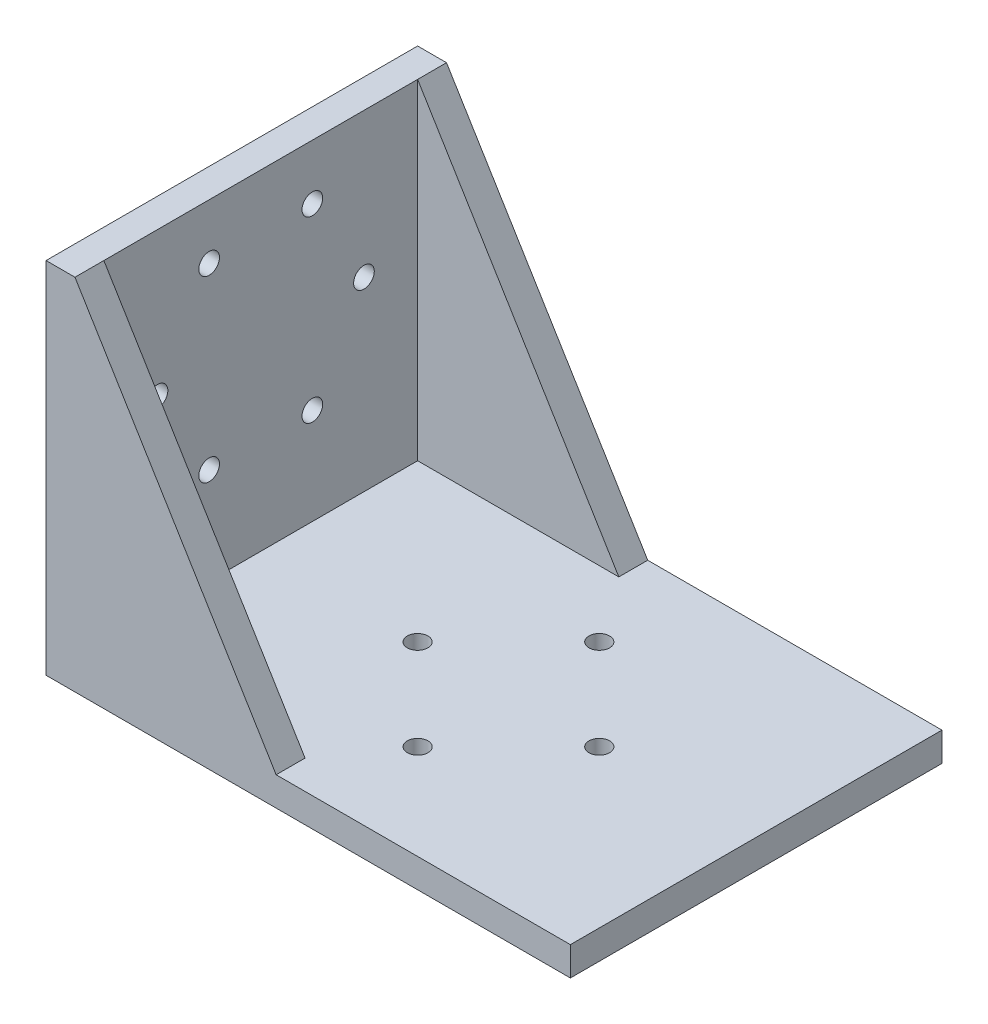
from build123d import *

# Parameters (mm, degrees)
SKETCH_1_W          = 120
SKETCH_1_H          = 70
EXTRUDE_1_DEPTH     = 7
SKETCH_2_R          = 2.5
CUT_EXTRUDE_2_DEPTH = 7
SKETCH_5_W          = 70
SKETCH_5_H          = 87
EXTRUDE_4_DEPTH     = 7
SKETCH_6_R          = 2.5
CUT_EXTRUDE_3_DEPTH = 7
EXTRUDE_5_DEPTH     = 10
EXTRUDE_6_DEPTH     = 10
EXTRUDE_7_DEPTH     = 7
EXTRUDE_8_DEPTH     = 7


with BuildPart() as part:
    # 草图1 → 凸台-拉伸1 (new body)
    with BuildSketch(Plane(origin=(0, 0, 0), x_dir=(1, 0, 0), z_dir=(0, 1, 0))):
        with Locations((60, 35)):
            Rectangle(SKETCH_1_W, SKETCH_1_H)
    extrude(amount=EXTRUDE_1_DEPTH)

    # 草图2 → 切除-拉伸2 (cut)
    with BuildSketch(Plane(origin=(0, 7, 0), x_dir=(1, 0, 0), z_dir=(0, 1, 0))):
        with Locations((82, 35)):
            Circle(SKETCH_2_R)
        with Locations((60, 13)):
            Circle(SKETCH_2_R)
        with Locations((38, 35)):
            Circle(SKETCH_2_R)
        with Locations((60, 57)):
            Circle(SKETCH_2_R)
    extrude(amount=-CUT_EXTRUDE_2_DEPTH, mode=Mode.SUBTRACT)

    # 草图5 → 凸台-拉伸4 (add)
    with BuildSketch(Plane.ZY):
        with Locations((-35, 43.5)):
            Rectangle(SKETCH_5_W, SKETCH_5_H)
    extrude(amount=EXTRUDE_4_DEPTH)

    # 草图6 → 切除-拉伸3 (cut)
    with BuildSketch(Plane.ZY.offset(7)):
        with Locations((-10, 52)):
            Circle(SKETCH_6_R)
        with Locations((-22.5, 30.349364905)):
            Circle(SKETCH_6_R)
        with Locations((-47.5, 30.349364905)):
            Circle(SKETCH_6_R)
        with Locations((-60, 52)):
            Circle(SKETCH_6_R)
        with Locations((-47.5, 73.650635095)):
            Circle(SKETCH_6_R)
        with Locations((-22.5, 73.650635095)):
            Circle(SKETCH_6_R)
    extrude(amount=-CUT_EXTRUDE_3_DEPTH, mode=Mode.SUBTRACT)

    # 草图7 → 凸台-拉伸5 (add)
    with BuildSketch(Plane.XY):
        Polygon((0, 87), (0, 7), (120, 7), (120, 0), (-7, 0), (-7, 87), align=None)
    extrude(amount=EXTRUDE_5_DEPTH)

    # 草图8 → 凸台-拉伸6 (add)
    with BuildSketch(Plane(origin=(0, 0, -70), x_dir=(-1, 0, 0), z_dir=(0, 0, -1))):
        Polygon((7, 87), (7, 0), (-120, 0), (-120, 7), (0, 7), (0, 87), align=None)
    extrude(amount=EXTRUDE_6_DEPTH)

    # 草图9 → 凸台-拉伸7 (add)
    with BuildSketch(Plane(origin=(0, 0, -80), x_dir=(-1, 0, 0), z_dir=(0, 0, -1))):
        Polygon((7, 0), (-53, 0), (0, 87), align=None)
    extrude(amount=-EXTRUDE_7_DEPTH)

    # 草图10 → 凸台-拉伸8 (add)
    with BuildSketch(Plane.XY.offset(10)):
        Polygon((-7, 0), (53, 0), (0, 87), align=None)
    extrude(amount=-EXTRUDE_8_DEPTH)


solid = part.part
